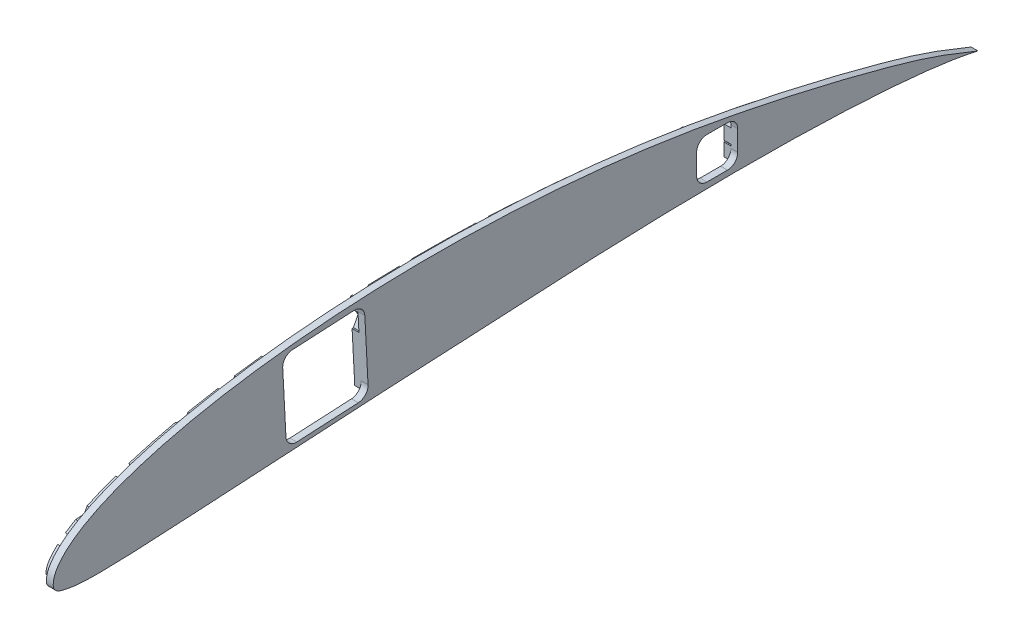
from build123d import *

# Parameters (mm, degrees)
BOSS_EXTRUDE1_DEPTH = 2
BOSS_EXTRUDE2_START = -2
BOSS_EXTRUDE2_DEPTH = 2
CUT_EXTRUDE1_DEPTH  = 2


with BuildPart() as part:
    # Sketch1 → Boss-Extrude1 (new body)
    with BuildSketch(Plane(origin=(-85, 0, 0), x_dir=(0, 0, -1), z_dir=(1, 0, 0))):
        with BuildLine():
            add(Edge.make_bspline(
                [(190.53448357, 89.072721427), (190.535919636, 89.081828832), (189.467417128, 89.425217072), (188.441252275, 89.872783655), (186.027820973, 90.827459538), (183.182886676, 91.992229884), (179.55702465, 93.372143859), (175.295914401, 94.826949141), (170.344597141, 96.337993262), (164.744659016, 97.932724617), (158.528211861, 99.607837261), (151.746707339, 101.339212369), (144.453170026, 103.108707861), (136.702732906, 104.890392559), (128.553762938, 106.659561416), (120.066077621, 108.381570745), (111.292067444, 110.025390209), (102.263562275, 111.519284961), (93.020190072, 112.851602053), (83.601686574, 114.022357534), (74.048871847, 114.998748781), (64.408281048, 115.793352177), (54.725155106, 116.390653188), (45.050288105, 116.779172951), (35.432492058, 116.975418138), (25.919401725, 116.959586285), (16.560368992, 116.74076938), (7.40288742, 116.32647405), (-1.504171197, 115.717651355), (-10.11421828, 114.927323247), (-18.381570928, 113.959909577), (-26.261233064, 112.823794126), (-33.71328319, 111.537165408), (-40.698199403, 110.103665866), (-47.180055651, 108.540976294), (-53.127671829, 106.866216493), (-58.508707688, 105.088513178), (-63.304185722, 103.240325905), (-67.489785727, 101.315824902), (-71.046447713, 99.331762689), (-73.993273466, 97.347269755), (-76.303086108, 95.33398605), (-77.98653705, 93.365804598), (-79.094379515, 91.461502287), (-79.493702484, 89.687577065), (-79.479737068, 88.038166111), (-78.295345279, 86.743713222), (-76.273919792, 86.211111221), (-73.564577489, 85.658107437), (-69.961745836, 85.401732978), (-65.525376255, 85.340429536), (-60.228088568, 85.457541648), (-54.097084819, 85.711820764), (-47.170128684, 86.068267509), (-39.499828274, 86.502540315), (-31.142993417, 87.001186262), (-22.160512565, 87.541000131), (-12.618741704, 88.111298067), (-2.587440241, 88.694451132), (7.859566002, 89.282636538), (18.645173354, 89.866325074), (29.692382125, 90.440310589), (40.928260572, 91.016590817), (52.292396353, 91.61483781), (63.735546655, 92.210504239), (75.200344697, 92.776823161), (86.607479353, 93.246897159), (97.85649978, 93.58911542), (108.845022208, 93.813469235), (119.47946118, 93.911933817), (129.670786104, 93.881272441), (139.330781808, 93.72264298), (148.373130308, 93.440863217), (156.715770872, 93.047395067), (164.277548712, 92.557412509), (170.993815262, 91.990988646), (176.773460385, 91.383093009), (181.623413381, 90.740701471), (185.283352784, 90.156362598), (188.202963592, 89.562555002), (189.395293398, 89.351544098), (190.533033196, 89.06352329), (190.53448357, 89.072721427)],
                knots=[0, 0, 0, 0, 0.000978925, 0.003785915, 0.008178786, 0.013939636, 0.020914584, 0.029056598, 0.038413559, 0.048973972, 0.060645419, 0.073333851, 0.086939075, 0.101355023, 0.116470865, 0.132170767, 0.148332165, 0.164889948, 0.181806831, 0.198986829, 0.216369093, 0.233891214, 0.251455205, 0.268989944, 0.286410199, 0.30363306, 0.320588513, 0.33718727, 0.353353473, 0.369012335, 0.384083455, 0.398499749, 0.412191497, 0.425098469, 0.437171363, 0.448351495, 0.458605679, 0.467900991, 0.476215593, 0.483572991, 0.489970137, 0.495456444, 0.500131703, 0.503991848, 0.507230008, 0.509986767, 0.512500662, 0.516073685, 0.521095012, 0.527571392, 0.53558732, 0.545177111, 0.556301643, 0.568874715, 0.582800206, 0.597975202, 0.614286016, 0.631612678, 0.649825892, 0.668791608, 0.688371086, 0.708416853, 0.728796853, 0.749399049, 0.770145767, 0.790953093, 0.811664203, 0.832074041, 0.851999344, 0.871281672, 0.889760566, 0.907279934, 0.923686414, 0.93883251, 0.952579327, 0.964796492, 0.975364982, 0.984179192, 0.991107071, 0.996049394, 0.999011322, 1, 1, 1, 1], degree=3))
        make_face()
        with BuildLine():
            Line((12.451997378, 93.722741999), (11.509950166, 111.698073624))
            ThreePointArc((11.509950166, 111.698073624), (10.521453381, 113.770500232), (8.357053693, 114.53695436))
            Line((8.357053693, 114.53695436), (-9.618277933, 113.594907147))
            ThreePointArc((-9.618277933, 113.594907147), (-11.690704541, 112.606410362), (-12.457158668, 110.442010674))
            Line((-12.457158668, 110.442010674), (-11.515111456, 92.466679049))
            ThreePointArc((-11.515111456, 92.466679049), (-10.526614671, 90.394252441), (-8.362214983, 89.627798313))
            Line((-8.362214983, 89.627798313), (9.613116643, 90.569845526))
            ThreePointArc((9.613116643, 90.569845526), (11.68554325, 91.558342311), (12.451997378, 93.722741999))
        make_face(mode=Mode.SUBTRACT)
        with BuildLine():
            Line((117.388529582, 107.5), (111.388529582, 107.5))
            ThreePointArc((111.388529582, 107.5), (109.267209239, 106.621320344), (108.388529582, 104.5))
            Line((108.388529582, 104.5), (108.388529582, 98.5))
            ThreePointArc((108.388529582, 98.5), (109.267209239, 96.378679656), (111.388529582, 95.5))
            Line((111.388529582, 95.5), (117.388529582, 95.5))
            ThreePointArc((117.388529582, 95.5), (119.509849926, 96.378679656), (120.388529582, 98.5))
            Line((120.388529582, 98.5), (120.388529582, 104.5))
            ThreePointArc((120.388529582, 104.5), (119.509849926, 106.621320344), (117.388529582, 107.5))
        make_face(mode=Mode.SUBTRACT)
    extrude(amount=BOSS_EXTRUDE1_DEPTH)

    # Sketch3 → Boss-Extrude2 (add)
    with BuildSketch(Plane(origin=(-83, 0, 0), x_dir=(0, 0, -1), z_dir=(1, 0, 0)).offset(BOSS_EXTRUDE2_START)):
        with BuildLine():
            Line((-12.565370312, 112.506811833), (-11.383904884, 89.963108517))
            Line((-11.383904884, 89.963108517), (-13.276498618, 89.963108517))
            add(Edge.make_bspline(
                [(-14.457964046, 112.506811833), (-17.343751921, 112.165163443), (-23.107619336, 111.401947119), (-31.707152962, 109.999992128), (-40.237712181, 108.293227939), (-48.674689748, 106.225610931), (-55.573248245, 104.122396341), (-60.964695232, 102.137172371), (-64.904250112, 100.463089802), (-68.680716372, 98.53869771), (-71.664169087, 96.686183691), (-73.807923401, 95.020894815), (-75.022308581, 93.875689243), (-75.88074879, 92.907551962), (-76.460694179, 92.148753734), (-76.956578335, 91.37082093), (-77.300270608, 90.642384984), (-77.471014973, 90.033772441), (-77.552968911, 89.495359868), (-77.583899948, 89.08958076), (-77.56230031, 88.833119161), (-77.545086805, 88.787994422), (-77.530291051, 88.755332018), (-77.367424788, 88.576128122), (-77.068170455, 88.394248377), (-76.367872763, 88.19533018), (-75.664312785, 88.03271259), (-74.991553022, 87.884924848), (-74.15083016, 87.722776441), (-73.157246332, 87.573485246), (-71.796635038, 87.427916591), (-69.328025103, 87.282514041), (-65.73750455, 87.235438129), (-61.396919801, 87.319408871), (-57.035656018, 87.47802482), (-52.667836086, 87.678924399), (-46.838182321, 87.97951272), (-39.546282571, 88.392606486), (-27.874478005, 89.089957263), (-19.115195168, 89.618425738), (-13.276498618, 89.963108517)],
                knots=[0.377129675, 0.377129675, 0.377129675, 0.377129675, 0.392991462, 0.408853249, 0.424715037, 0.440576824, 0.456438612, 0.464369505, 0.472300399, 0.480231293, 0.488162186, 0.492127633, 0.49609308, 0.498075804, 0.500058527, 0.50204125, 0.504023974, 0.506006697, 0.506998059, 0.507989421, 0.508980782, 0.509972144, 0.510963506, 0.511954868, 0.513937591, 0.515920314, 0.516911676, 0.517903038, 0.519885761, 0.521868485, 0.523851208, 0.527816655, 0.535747549, 0.543678442, 0.551609336, 0.55954023, 0.567471123, 0.583332911, 0.599194698, 0.630918273, 0.630918273, 0.630918273, 0.630918273], degree=3))
            Line((-14.457964046, 112.506811833), (-12.565370312, 112.506811833))
        make_face()
        with BuildLine():
            Line((11.352942297, 114.693962229), (12.571804406, 91.436687732))
            Line((12.571804406, 91.436687732), (14.374274628, 91.436687732))
            add(Edge.make_bspline(
                [(14.374274628, 91.436687732), (22.051573343, 91.850211376), (37.411254732, 92.630658502), (60.432369932, 93.852840438), (83.491572664, 94.994376177), (98.889783339, 95.425576603), (106.588529582, 95.557427244)],
                knots=[0.680968072, 0.680968072, 0.680968072, 0.680968072, 0.722665968, 0.764363864, 0.80606176, 0.847759656, 0.847759656, 0.847759656, 0.847759656], degree=3))
            Line((106.588529582, 95.557427244), (108.388529582, 95.557427244))
            Line((108.388529582, 95.557427244), (108.388529582, 108.971039261))
            Line((108.388529582, 108.971039261), (106.588529582, 108.971039261))
            add(Edge.make_bspline(
                [(106.588529582, 108.971039261), (98.879319209, 110.248200121), (83.391963668, 112.398560403), (60.025637761, 114.44583971), (36.586259692, 115.331271248), (20.956374793, 115.107286311), (13.151181903, 114.774687199)],
                knots=[1.156542309, 1.156542309, 1.156542309, 1.156542309, 1.199101492, 1.241660675, 1.284219858, 1.326779041, 1.326779041, 1.326779041, 1.326779041], degree=3))
            Line((13.151181903, 114.774687199), (11.352942297, 114.693962229))
        make_face()
        with BuildLine():
            Line((120.388529582, 106.357427244), (120.388529582, 95.357427244))
            Line((120.388529582, 95.357427244), (122.188529582, 95.357427244))
            Line((122.188529582, 95.357427244), (162.188529582, 93.892974612))
            add(Edge.make_bspline(
                [(162.188529582, 93.892974612), (142.993873874, 102.47243914), (122.188529582, 106.357427244)],
                knots=[0, 0, 0, 1, 1, 1], degree=2))
            Line((122.188529582, 106.357427244), (120.388529582, 106.357427244))
        make_face()
    extrude(amount=-BOSS_EXTRUDE2_DEPTH)

    # Sketch4 → Cut-Extrude1 (cut)
    with BuildSketch(Plane.ZY.offset(87)):
        Polygon((71.033530845, 100.813740893), (69.671559345, 103.486760465), (66.675670741, 103.643768334), (65.041753636, 101.12775663), (66.403725135, 98.454737057), (69.39961374, 98.297729189), align=None)
        Polygon((74.665454843, 93.685688699), (73.303483343, 96.358708272), (70.307594739, 96.51571614), (68.673677634, 93.999704437), (70.035649133, 91.326684864), (73.031537737, 91.169676995), align=None)
        Polygon((78.29737884, 86.557636506), (76.935407341, 89.230656078), (73.939518737, 89.387663947), (72.305601632, 86.871652243), (73.667573131, 84.19863267), (76.663461735, 84.041624802), align=None)
        Polygon((57.936741653, 102.121593802), (56.574770153, 104.794613375), (53.578881549, 104.951621243), (51.944964444, 102.43560954), (53.306935943, 99.762589967), (56.302824548, 99.605582098), align=None)
        Polygon((61.56866565, 94.993541609), (60.206694151, 97.666561181), (57.210805547, 97.82356905), (55.576888442, 95.307557346), (56.938859941, 92.634537774), (59.934748545, 92.477529905), align=None)
        Polygon((65.200589648, 87.865489415), (63.838618149, 90.538508988), (60.842729545, 90.695516856), (59.20881244, 88.179505153), (60.570783939, 85.50648558), (63.566672543, 85.349477711), align=None)
        Polygon((44.839952461, 103.429446712), (43.477980961, 106.102466284), (40.482092357, 106.259474153), (38.848175252, 103.743462449), (40.210146751, 101.070442877), (43.206035355, 100.913435008), align=None)
        Polygon((48.471876458, 96.301394518), (47.109904959, 98.974414091), (44.114016355, 99.13142196), (42.48009925, 96.615410256), (43.842070749, 93.942390683), (46.837959353, 93.785382814), align=None)
        Polygon((52.103800456, 89.173342325), (50.741828957, 91.846361897), (47.745940353, 92.003369766), (46.112023248, 89.487358062), (47.473994747, 86.81433849), (50.469883351, 86.657330621), align=None)
        Polygon((31.743163268, 104.737299621), (30.381191769, 107.410319194), (27.385303165, 107.567327063), (25.75138606, 105.051315359), (27.113357559, 102.378295786), (30.109246163, 102.221287918), align=None)
        Polygon((35.375087266, 97.609247428), (34.013115767, 100.282267), (31.017227163, 100.439274869), (29.383310058, 97.923263165), (30.745281557, 95.250243593), (33.741170161, 95.093235724), align=None)
        Polygon((39.007011264, 90.481195234), (37.645039765, 93.154214807), (34.649151161, 93.311222676), (33.015234056, 90.795210972), (34.377205555, 88.122191399), (37.373094159, 87.965183531), align=None)
        Polygon((18.646374076, 106.045152531), (17.284402577, 108.718172104), (14.288513973, 108.875179972), (12.654596868, 106.359168268), (14.016568367, 103.686148696), (17.012456971, 103.529140827), align=None)
        Polygon((22.278298074, 98.917100338), (20.916326575, 101.59011991), (17.920437971, 101.747127779), (16.286520866, 99.231116075), (17.648492365, 96.558096502), (20.644380969, 96.401088634), align=None)
        Polygon((25.910222072, 91.789048144), (24.548250573, 94.462067717), (21.552361969, 94.619075585), (19.918444864, 92.103063881), (21.280416363, 89.430044309), (24.276304967, 89.27303644), align=None)
        Polygon((5.549584884, 107.353005441), (4.187613385, 110.026025013), (1.191724781, 110.183032882), (-0.442192324, 107.667021178), (0.919779175, 104.994001606), (3.915667779, 104.836993737), align=None)
        Polygon((9.181508882, 100.224953247), (7.819537383, 102.89797282), (4.823648779, 103.054980688), (3.189731674, 100.538968985), (4.551703173, 97.865949412), (7.547591777, 97.708941543), align=None)
        Polygon((12.81343288, 93.096901054), (11.451461381, 95.769920626), (8.455572777, 95.926928495), (6.821655672, 93.410916791), (8.183627171, 90.737897219), (11.179515775, 90.58088935), align=None)
        Polygon((-7.547204308, 108.66085835), (-8.909175807, 111.333877923), (-11.905064411, 111.490885792), (-13.538981516, 108.974874088), (-12.177010017, 106.301854515), (-9.181121413, 106.144846646), align=None)
        Polygon((-3.91528031, 101.532806157), (-5.277251809, 104.205825729), (-8.273140413, 104.362833598), (-9.907057518, 101.846821894), (-8.545086019, 99.173802322), (-5.549197415, 99.016794453), align=None)
        Polygon((-0.283356312, 94.404753963), (-1.645327811, 97.077773536), (-4.641216415, 97.234781405), (-6.27513352, 94.718769701), (-4.913162021, 92.045750128), (-1.917273417, 91.888742259), align=None)
        Polygon((-20.6439935, 109.96871126), (-22.005964999, 112.641730832), (-25.001853603, 112.798738701), (-26.635770708, 110.282726997), (-25.273799209, 107.609707425), (-22.277910605, 107.452699556), align=None)
        Polygon((-17.012069502, 102.840659066), (-18.374041001, 105.513678639), (-21.369929605, 105.670686508), (-23.00384671, 103.154674804), (-21.641875211, 100.481655231), (-18.645986607, 100.324647363), align=None)
        Polygon((-13.380145504, 95.712606873), (-14.742117003, 98.385626445), (-17.738005607, 98.542634314), (-19.371922712, 96.02662261), (-18.009951213, 93.353603038), (-15.014062609, 93.196595169), align=None)
        Polygon((-33.740782692, 111.276564169), (-35.102754191, 113.949583742), (-38.098642795, 114.106591611), (-39.7325599, 111.590579907), (-38.370588401, 108.917560334), (-35.374699797, 108.760552466), align=None)
        Polygon((-30.108858694, 104.148511976), (-31.470830193, 106.821531549), (-34.466718797, 106.978539417), (-36.100635902, 104.462527713), (-34.738664403, 101.789508141), (-31.742775799, 101.632500272), align=None)
        Polygon((-26.476934696, 97.020459782), (-27.838906195, 99.693479355), (-30.834794799, 99.850487224), (-32.468711904, 97.33447552), (-31.106740405, 94.661455947), (-28.110851801, 94.504448079), align=None)
        Polygon((-46.837571884, 112.584417079), (-48.199543383, 115.257436652), (-51.195431987, 115.41444452), (-52.829349092, 112.898432817), (-51.467377593, 110.225413244), (-48.471488989, 110.068405375), align=None)
        Polygon((-43.205647886, 105.456364886), (-44.567619385, 108.129384458), (-47.563507989, 108.286392327), (-49.197425094, 105.770380623), (-47.835453595, 103.09736105), (-44.839564991, 102.940353182), align=None)
        Polygon((-39.573723888, 98.328312692), (-40.935695387, 101.001332265), (-43.931583991, 101.158340133), (-45.565501096, 98.64232843), (-44.203529597, 95.969308857), (-41.207640993, 95.812300988), align=None)
        Polygon((-59.934361076, 113.892269989), (-61.296332575, 116.565289561), (-64.292221179, 116.72229743), (-65.926138284, 114.206285726), (-64.564166785, 111.533266154), (-61.568278181, 111.376258285), align=None)
        Polygon((-56.302437078, 106.764217795), (-57.664408577, 109.437237368), (-60.660297181, 109.594245237), (-62.294214286, 107.078233533), (-60.932242787, 104.40521396), (-57.936354183, 104.248206091), align=None)
        Polygon((-52.67051308, 99.636165602), (-54.032484579, 102.309185174), (-57.028373183, 102.466193043), (-58.662290289, 99.950181339), (-57.300318789, 97.277161767), (-54.304430185, 97.120153898), align=None)
        Polygon((-73.031150268, 115.200122898), (-74.393121767, 117.873142471), (-77.389010371, 118.03015034), (-79.022927476, 115.514138636), (-77.660955977, 112.841119063), (-74.665067373, 112.684111195), align=None)
        Polygon((-69.39922627, 108.072070705), (-70.761197769, 110.745090277), (-73.757086373, 110.902098146), (-75.391003479, 108.386086442), (-74.029031979, 105.71306687), (-71.033143375, 105.556059001), align=None)
        Polygon((-65.767302272, 100.944018511), (-67.129273771, 103.617038084), (-70.125162376, 103.774045953), (-71.759079481, 101.258034249), (-70.397107981, 98.585014676), (-67.401219377, 98.428006807), align=None)
        Polygon((-86.12793946, 116.507975808), (-87.489910959, 119.180995381), (-90.485799563, 119.338003249), (-92.119716668, 116.821991545), (-90.757745169, 114.148971973), (-87.761856565, 113.991964104), align=None)
        Polygon((-82.496015462, 109.379923614), (-83.857986961, 112.052943187), (-86.853875566, 112.209951056), (-88.487792671, 109.693939352), (-87.125821171, 107.020919779), (-84.129932567, 106.863911911), align=None)
        Polygon((-78.864091464, 102.251871421), (-80.226062963, 104.924890994), (-83.221951568, 105.081898862), (-84.855868673, 102.565887158), (-83.493897173, 99.892867586), (-80.498008569, 99.735859717), align=None)
        Polygon((-99.224728652, 117.815828718), (-100.586700151, 120.48884829), (-103.582588755, 120.645856159), (-105.216505861, 118.129844455), (-103.854534361, 115.456824882), (-100.858645757, 115.299817014), align=None)
        Polygon((-95.592804654, 110.687776524), (-96.954776153, 113.360796097), (-99.950664758, 113.517803965), (-101.584581863, 111.001792262), (-100.222610363, 108.328772689), (-97.226721759, 108.17176482), align=None)
        Polygon((-91.960880656, 103.559724331), (-93.322852155, 106.232743903), (-96.31874076, 106.389751772), (-97.952657865, 103.873740068), (-96.590686365, 101.200720495), (-93.594797761, 101.043712627), align=None)
        Polygon((-112.321517844, 119.123681627), (-113.683489343, 121.7967012), (-116.679377948, 121.953709068), (-118.313295053, 119.437697365), (-116.951323553, 116.764677792), (-113.955434949, 116.607669923), align=None)
        Polygon((-108.689593846, 111.995629434), (-110.051565345, 114.668649006), (-113.04745395, 114.825656875), (-114.681371055, 112.309645171), (-113.319399555, 109.636625599), (-110.323510951, 109.47961773), align=None)
        Polygon((-105.057669848, 104.86757724), (-106.419641347, 107.540596813), (-109.415529952, 107.697604681), (-111.049447057, 105.181592978), (-109.687475558, 102.508573405), (-106.691586953, 102.351565536), align=None)
        Polygon((-125.418307036, 120.431534537), (-126.780278535, 123.104554109), (-129.77616714, 123.261561978), (-131.410084245, 120.745550274), (-130.048112745, 118.072530702), (-127.052224141, 117.915522833), align=None)
        Polygon((-121.786383038, 113.303482343), (-123.148354537, 115.976501916), (-126.144243142, 116.133509785), (-127.778160247, 113.617498081), (-126.416188747, 110.944478508), (-123.420300143, 110.787470639), align=None)
        Polygon((-118.15445904, 106.17543015), (-119.516430539, 108.848449722), (-122.512319144, 109.005457591), (-124.146236249, 106.489445887), (-122.78426475, 103.816426315), (-119.788376145, 103.659418446), align=None)
        Polygon((-138.515096228, 121.739387446), (-139.877067727, 124.412407019), (-142.872956332, 124.569414888), (-144.506873437, 122.053403184), (-143.144901937, 119.380383611), (-140.149013333, 119.223375743), align=None)
        Polygon((-134.88317223, 114.611335253), (-136.245143729, 117.284354825), (-139.241032334, 117.441362694), (-140.874949439, 114.92535099), (-139.51297794, 112.252331418), (-136.517089335, 112.095323549), align=None)
        Polygon((-131.251248232, 107.483283059), (-132.613219732, 110.156302632), (-135.609108336, 110.313310501), (-137.243025441, 107.797298797), (-135.881053942, 105.124279224), (-132.885165337, 104.967271356), align=None)
        Polygon((-151.61188542, 123.047240356), (-152.973856919, 125.720259929), (-155.969745524, 125.877267797), (-157.603662629, 123.361256094), (-156.241691129, 120.688236521), (-153.245802525, 120.531228652), align=None)
        Polygon((-147.979961422, 115.919188163), (-149.341932921, 118.592207735), (-152.337821526, 118.749215604), (-153.971738631, 116.2332039), (-152.609767132, 113.560184327), (-149.613878527, 113.403176459), align=None)
        Polygon((-144.348037424, 108.791135969), (-145.710008924, 111.464155542), (-148.705897528, 111.62116341), (-150.339814633, 109.105151706), (-148.977843134, 106.432132134), (-145.981954529, 106.275124265), align=None)
        Polygon((-164.708674612, 124.355093266), (-166.070646111, 127.028112838), (-169.066534716, 127.185120707), (-170.700451821, 124.669109003), (-169.338480322, 121.996089431), (-166.342591717, 121.839081562), align=None)
        Polygon((-161.076750614, 117.227041072), (-162.438722114, 119.900060645), (-165.434610718, 120.057068513), (-167.068527823, 117.54105681), (-165.706556324, 114.868037237), (-162.710667719, 114.711029368), align=None)
        Polygon((-157.444826616, 110.098988879), (-158.806798116, 112.772008451), (-161.80268672, 112.92901632), (-163.436603825, 110.413004616), (-162.074632326, 107.739985044), (-159.078743721, 107.582977175), align=None)
        Polygon((-177.805463804, 125.662946175), (-179.167435303, 128.335965748), (-182.163323908, 128.492973617), (-183.797241013, 125.976961913), (-182.435269514, 123.30394234), (-179.439380909, 123.146934471), align=None)
        Polygon((-174.173539806, 118.534893982), (-175.535511306, 121.207913554), (-178.53139991, 121.364921423), (-180.165317015, 118.848909719), (-178.803345516, 116.175890147), (-175.807456911, 116.018882278), align=None)
        Polygon((-170.541615808, 111.406841788), (-171.903587308, 114.079861361), (-174.899475912, 114.23686923), (-176.533393017, 111.720857526), (-175.171421518, 109.047837953), (-172.175532913, 108.890830084), align=None)
        Polygon((67.470542147, 83.410456794), (64.474653543, 83.567464663), (62.840736438, 81.051452959), (64.202707937, 78.378433387), (67.198596541, 78.221425518), (68.832513646, 80.737437222), align=None)
        Polygon((80.567331339, 82.102603885), (77.571442735, 82.259611753), (75.93752563, 79.743600049), (77.299497129, 77.070580477), (80.295385733, 76.913572608), (81.929302838, 79.429584312), align=None)
        Polygon((66.039635347, 110.614812659), (63.043746743, 110.771820527), (61.409829638, 108.255808824), (62.771801137, 105.582789251), (65.767689742, 105.425781382), (67.401606847, 107.941793086), align=None)
        Polygon((52.942846155, 111.922665568), (49.946957551, 112.079673437), (48.313040446, 109.563661733), (49.675011945, 106.890642161), (52.67090055, 106.733634292), (54.304817655, 109.249645996), align=None)
        Polygon((54.373752955, 84.718309704), (51.377864351, 84.875317573), (49.743947246, 82.359305869), (51.105918745, 79.686286296), (54.101807349, 79.529278427), (55.735724454, 82.045290131), align=None)
        Polygon((39.846056963, 113.230518478), (36.850168359, 113.387526347), (35.216251254, 110.871514643), (36.578222753, 108.19849507), (39.574111358, 108.041487201), (41.208028463, 110.557498905), align=None)
        Polygon((41.276963763, 86.026162613), (38.281075159, 86.183170482), (36.647158054, 83.667158778), (38.009129553, 80.994139206), (41.005018157, 80.837131337), (42.638935262, 83.353143041), align=None)
        Polygon((26.749267771, 114.538371387), (23.753379167, 114.695379256), (22.119462062, 112.179367552), (23.481433561, 109.50634798), (26.477322166, 109.349340111), (28.111239271, 111.865351815), align=None)
        Polygon((28.180174571, 87.334015523), (25.184285967, 87.491023392), (23.550368862, 84.975011688), (24.912340361, 82.301992115), (27.908228965, 82.144984247), (29.54214607, 84.660995951), align=None)
        Polygon((13.652478579, 115.846224297), (10.656589975, 116.003232166), (9.02267287, 113.487220462), (10.384644369, 110.814200889), (13.380532973, 110.657193021), (15.014450079, 113.173204725), align=None)
        Polygon((15.083385379, 88.641868433), (12.087496775, 88.798876301), (10.45357967, 86.282864598), (11.815551169, 83.609845025), (14.811439773, 83.452837156), (16.445356878, 85.96884886), align=None)
        Polygon((0.555689387, 117.154077207), (-2.440199217, 117.311085075), (-4.074116322, 114.795073372), (-2.712144823, 112.122053799), (0.283743781, 111.96504593), (1.917660886, 114.481057634), align=None)
        Polygon((1.986596187, 89.949721342), (-1.009292417, 90.106729211), (-2.643209522, 87.590717507), (-1.281238023, 84.917697935), (1.714650581, 84.760690066), (3.348567686, 87.27670177), align=None)
        Polygon((-12.541099805, 118.461930116), (-15.536988409, 118.618937985), (-17.170905514, 116.102926281), (-15.808934015, 113.429906709), (-12.813045411, 113.27289884), (-11.179128306, 115.788910544), align=None)
        Polygon((-11.110193005, 91.257574252), (-14.106081609, 91.414582121), (-15.739998714, 88.898570417), (-14.378027215, 86.225550844), (-11.382138611, 86.068542976), (-9.748221506, 88.584554679), align=None)
        Polygon((-25.637888997, 119.769783026), (-28.633777601, 119.926790895), (-30.267694706, 117.410779191), (-28.905723207, 114.737759618), (-25.909834603, 114.58075175), (-24.275917498, 117.096763453), align=None)
        Polygon((-24.206982197, 92.565427162), (-27.202870801, 92.72243503), (-28.836787907, 90.206423326), (-27.474816407, 87.533403754), (-24.478927803, 87.376395885), (-22.845010698, 89.892407589), align=None)
        Polygon((-38.734678189, 121.077635936), (-41.730566793, 121.234643804), (-43.364483898, 118.7186321), (-42.002512399, 116.045612528), (-39.006623795, 115.888604659), (-37.37270669, 118.404616363), align=None)
        Polygon((-37.303771389, 93.873280071), (-40.299659994, 94.03028794), (-41.933577099, 91.514276236), (-40.571605599, 88.841256663), (-37.575716995, 88.684248795), (-35.94179989, 91.200260499), align=None)
        Polygon((-51.831467381, 122.385488845), (-54.827355985, 122.542496714), (-56.46127309, 120.02648501), (-55.099301591, 117.353465438), (-52.103412987, 117.196457569), (-50.469495882, 119.712469273), align=None)
        Polygon((-50.400560581, 95.181132981), (-53.396449186, 95.33814085), (-55.030366291, 92.822129146), (-53.668394791, 90.149109573), (-50.672506187, 89.992101704), (-49.038589082, 92.508113408), align=None)
        Polygon((-64.928256573, 123.693341755), (-67.924145177, 123.850349624), (-69.558062282, 121.33433792), (-68.196090783, 118.661318347), (-65.200202179, 118.504310478), (-63.566285074, 121.020322182), align=None)
        Polygon((-63.497349773, 96.48898589), (-66.493238378, 96.645993759), (-68.127155483, 94.129982055), (-66.765183983, 91.456962483), (-63.769295379, 91.299954614), (-62.135378274, 93.815966318), align=None)
        Polygon((-78.025045765, 125.001194664), (-81.020934369, 125.158202533), (-82.654851474, 122.642190829), (-81.292879975, 119.969171257), (-78.296991371, 119.812163388), (-76.663074266, 122.328175092), align=None)
        Polygon((-76.594138965, 97.7968388), (-79.59002757, 97.953846669), (-81.223944675, 95.437834965), (-79.861973176, 92.764815392), (-76.866084571, 92.607807524), (-75.232167466, 95.123819227), align=None)
        Polygon((-91.121834957, 126.309047574), (-94.117723561, 126.466055443), (-95.751640666, 123.950043739), (-94.389669167, 121.277024166), (-91.393780563, 121.120016298), (-89.759863458, 123.636028001), align=None)
        Polygon((-89.690928157, 99.10469171), (-92.686816762, 99.261699578), (-94.320733867, 96.745687875), (-92.958762368, 94.072668302), (-89.962873763, 93.915660433), (-88.328956658, 96.431672137), align=None)
        Polygon((-104.218624149, 127.616900484), (-107.214512753, 127.773908352), (-108.848429858, 125.257896649), (-107.486458359, 122.584877076), (-104.490569755, 122.427869207), (-102.85665265, 124.943880911), align=None)
        Polygon((-102.78771735, 100.412544619), (-105.783605954, 100.569552488), (-107.417523059, 98.053540784), (-106.05555156, 95.380521212), (-103.059662955, 95.223513343), (-101.42574585, 97.739525047), align=None)
        Polygon((-117.315413341, 128.924753393), (-120.311301945, 129.081761262), (-121.94521905, 126.565749558), (-120.583247551, 123.892729986), (-117.587358947, 123.735722117), (-115.953441842, 126.251733821), align=None)
        Polygon((-115.884506542, 101.720397529), (-118.880395146, 101.877405398), (-120.514312251, 99.361393694), (-119.152340752, 96.688374121), (-116.156452147, 96.531366252), (-114.522535042, 99.047377956), align=None)
        Polygon((-130.412202533, 130.232606303), (-133.408091137, 130.389614172), (-135.042008243, 127.873602468), (-133.680036743, 125.200582895), (-130.684148139, 125.043575026), (-129.050231034, 127.55958673), align=None)
        Polygon((-128.981295734, 103.028250438), (-131.977184338, 103.185258307), (-133.611101443, 100.669246603), (-132.249129944, 97.996227031), (-129.253241339, 97.839219162), (-127.619324234, 100.355230866), align=None)
        Polygon((-143.508991725, 131.540459213), (-146.50488033, 131.697467081), (-148.138797435, 129.181455377), (-146.776825935, 126.508435805), (-143.780937331, 126.351427936), (-142.147020226, 128.86743964), align=None)
        Polygon((-142.078084926, 104.336103348), (-145.07397353, 104.493111217), (-146.707890635, 101.977099513), (-145.345919136, 99.30407994), (-142.350030531, 99.147072072), (-140.716113426, 101.663083776), align=None)
        Polygon((-156.605780917, 132.848312122), (-159.601669522, 133.005319991), (-161.235586627, 130.489308287), (-159.873615127, 127.816288714), (-156.877726523, 127.659280846), (-155.243809418, 130.17529255), align=None)
        Polygon((-155.174874118, 105.643956258), (-158.170762722, 105.800964126), (-159.804679827, 103.284952423), (-158.442708328, 100.61193285), (-155.446819724, 100.454924981), (-153.812902618, 102.970936685), align=None)
        Polygon((-169.702570109, 134.156165032), (-172.698458714, 134.3131729), (-174.332375819, 131.797161197), (-172.970404319, 129.124141624), (-169.974515715, 128.967133755), (-168.34059861, 131.483145459), align=None)
        Polygon((-168.27166331, 106.951809167), (-171.267551914, 107.108817036), (-172.901469019, 104.592805332), (-171.53949752, 101.91978576), (-168.543608916, 101.762777891), (-166.909691811, 104.278789595), align=None)
        Polygon((-182.799359301, 135.464017941), (-185.795247906, 135.62102581), (-187.429165011, 133.105014106), (-186.067193512, 130.431994534), (-183.071304907, 130.274986665), (-181.437387802, 132.790998369), align=None)
        Polygon((72.485681878, 73.600497157), (71.123710379, 76.273516729), (68.127821774, 76.430524598), (66.493904669, 73.914512894), (67.855876169, 71.241493322), (70.851764773, 71.084485453), align=None)
        Polygon((85.561226836, 72.301532119), (84.199255337, 74.974551691), (81.203366733, 75.13155956), (79.569449628, 72.615547856), (80.931421127, 69.942528283), (83.927309731, 69.785520415), align=None)
        Polygon((59.410136919, 74.899462195), (58.04816542, 77.572481768), (55.052276816, 77.729489636), (53.418359711, 75.213477932), (54.78033121, 72.54045836), (57.776219814, 72.383450491), align=None)
        Polygon((46.334591961, 76.198427233), (44.972620462, 78.871446806), (41.976731857, 79.028454675), (40.342814752, 76.512442971), (41.704786252, 73.839423398), (44.700674856, 73.682415529), align=None)
        Polygon((33.259047003, 77.497392271), (31.897075503, 80.170411844), (28.901186899, 80.327419713), (27.267269794, 77.811408009), (28.629241293, 75.138388436), (31.625129897, 74.981380568), align=None)
        Polygon((20.183502044, 78.79635731), (18.821530545, 81.469376882), (15.825641941, 81.626384751), (14.191724836, 79.110373047), (15.553696335, 76.437353475), (18.549584939, 76.280345606), align=None)
        Polygon((7.107957086, 80.095322348), (5.745985586, 82.768341921), (2.750096982, 82.925349789), (1.116179877, 80.409338085), (2.478151376, 77.736318513), (5.474039981, 77.579310644), align=None)
        Polygon((-5.967587873, 81.394287386), (-7.329559372, 84.067306959), (-10.325447976, 84.224314827), (-11.959365081, 81.708303124), (-10.597393582, 79.035283551), (-7.601504978, 78.878275682), align=None)
        Polygon((-19.043132831, 82.693252424), (-20.40510433, 85.366271997), (-23.400992935, 85.523279866), (-25.03491004, 83.007268162), (-23.672938541, 80.334248589), (-20.677049936, 80.177240721), align=None)
        Polygon((-32.11867779, 83.992217463), (-33.480649289, 86.665237035), (-36.476537893, 86.822244904), (-38.110454998, 84.3062332), (-36.748483499, 81.633213628), (-33.752594895, 81.476205759), align=None)
        Polygon((-45.194222748, 85.291182501), (-46.556194247, 87.964202073), (-49.552082852, 88.121209942), (-51.185999957, 85.605198238), (-49.824028457, 82.932178666), (-46.828139853, 82.775170797), align=None)
        Polygon((-58.269767707, 86.590147539), (-59.631739206, 89.263167112), (-62.62762781, 89.42017498), (-64.261544915, 86.904163277), (-62.899573416, 84.231143704), (-59.903684812, 84.074135835), align=None)
        Polygon((-71.345312665, 87.889112577), (-72.707284164, 90.56213215), (-75.703172768, 90.719140019), (-77.337089874, 88.203128315), (-75.975118374, 85.530108742), (-72.97922977, 85.373100874), align=None)
        Polygon((-84.420857623, 89.188077616), (-85.782829123, 91.861097188), (-88.778717727, 92.018105057), (-90.412634832, 89.502093353), (-89.050663333, 86.829073781), (-86.054774728, 86.672065912), align=None)
        Polygon((-97.496402582, 90.487042654), (-98.858374081, 93.160062226), (-101.854262685, 93.317070095), (-103.48817979, 90.801058391), (-102.126208291, 88.128038819), (-99.130319687, 87.97103095), align=None)
        Polygon((-110.57194754, 91.786007692), (-111.93391904, 94.459027265), (-114.929807644, 94.616035133), (-116.563724749, 92.10002343), (-115.20175325, 89.427003857), (-112.205864645, 89.269995988), align=None)
        Polygon((-123.647492499, 93.08497273), (-125.009463998, 95.757992303), (-128.005352602, 95.915000172), (-129.639269707, 93.398988468), (-128.277298208, 90.725968895), (-125.281409604, 90.568961026), align=None)
        Polygon((-136.723037457, 94.383937769), (-138.085008956, 97.056957341), (-141.080897561, 97.21396521), (-142.714814666, 94.697953506), (-141.352843167, 92.024933933), (-138.356954562, 91.867926065), align=None)
        Polygon((-149.798582416, 95.682902807), (-151.160553915, 98.355922379), (-154.156442519, 98.512930248), (-155.790359624, 95.996918544), (-154.428388125, 93.323898972), (-151.432499521, 93.166891103), align=None)
        Polygon((-162.874127374, 96.981867845), (-164.236098873, 99.654887418), (-167.231987478, 99.811895286), (-168.865904583, 97.295883583), (-167.503933083, 94.62286401), (-164.508044479, 94.465856141), align=None)
    extrude(amount=-CUT_EXTRUDE1_DEPTH, mode=Mode.SUBTRACT)


solid = part.part
